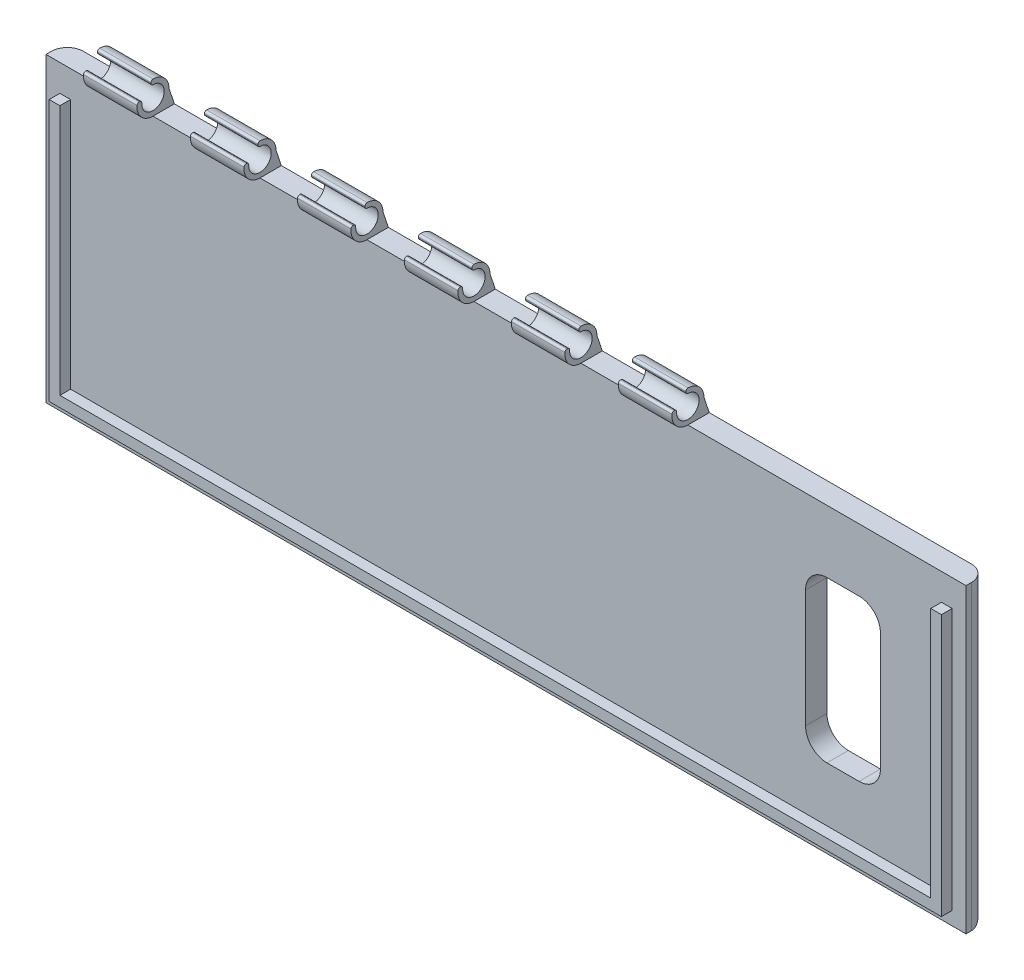
from build123d import *

# Parameters (mm, degrees)
SKETCH1_W               = 86
SKETCH1_H               = 28.2
BOSS_EXTRUDE1_DEPTH     = 2
SKETCH5_R               = 1.05
BOSS_EXTRUDE2_DEPTH     = 5
SKETCH8_W               = 1.75956426
SKETCH8_H               = 1.75956426
CUT_EXTRUDE3_DEPTH      = 5
FILLET4_R               = 0.2
LPATTERN1_COUNT         = 12
LPATTERN1_PITCH         = 5
LPATTERN1_2_COUNT       = 12
LPATTERN1_2_PITCH       = 5
FILLET4_OF_LPATTERN1_R  = 0.2
CUT_EXTRUDE1_START      = -43
CUT_EXTRUDE1_DEPTH      = 5
FILLET5_R               = 1.5
BOSS_EXTRUDE3_DEPTH     = 1
CUT_EXTRUDE6_DEPTH      = 47.407525329
CUT_EXTRUDE6_DEPTH_BACK = 47.407525329
SKETCH10_W              = 7
SKETCH10_H              = 15
FILLET6_R               = 2


# Read off the part's stored shape, not the designer's step: Cut-Extrude1
with BuildPart() as part:
    # Sketch1 → Boss-Extrude1 (new body)
    with BuildSketch(Plane.XY):
        Rectangle(SKETCH1_W, SKETCH1_H)
    extrude(amount=BOSS_EXTRUDE1_DEPTH)


with BuildPart() as body_2:
    # Sketch5 → Boss-Extrude2 (new body)
    with BuildSketch(Plane.ZY.offset(43)):
        with BuildLine():
            Line((0.5, 15.6), (0, 14.1))
            Line((0, 14.1), (2, 14.1))
            ThreePointArc((2, 14.1), (3.060660172, 16.660660172), (0.5, 15.6))
        make_face()
        with Locations((2, 15.6)):
            Circle(SKETCH5_R, mode=Mode.SUBTRACT)
    boss_extrude2 = extrude(amount=-BOSS_EXTRUDE2_DEPTH)

    # Sketch8 → Cut-Extrude3 (cut)
    with BuildSketch(Plane.ZY.offset(43)):
        with Locations((3.068777943, 16.78020761)):
            Rectangle(SKETCH8_W, SKETCH8_H)
    cut_extrude3 = extrude(amount=-CUT_EXTRUDE3_DEPTH, mode=Mode.SUBTRACT)

    # Fillet4
    fillet4_edges = [body_2.edges().sort_by_distance(p)[0] for p in [
        (-40.5, 16.632850707, 2.188995813),
        (-40.5, 15.90042548, 3.006103638),
        (-40.5, 17.088045894, 2.188995813),
        (-40.5, 15.90042548, 3.469606931),
    ]]
    fillet(fillet4_edges, radius=FILLET4_R)


with BuildPart() as part_1:
    add(part.part)

    add(body_2.part)  # LPattern1 merges body 2
    # LPattern1: Boss-Extrude2 ×12, 5 skipped
    with Locations(*[(i * LPATTERN1_PITCH, 0, 0) for i in range(1, LPATTERN1_COUNT) if i not in (2, 4, 6, 8, 10)]):
        add(boss_extrude2)

    # LPattern1 2: Cut-Extrude3 ×12, 5 skipped
    with Locations(*[(i * LPATTERN1_2_PITCH, 0, 0) for i in range(1, LPATTERN1_2_COUNT) if i not in (2, 4, 6, 8, 10)]):
        add(cut_extrude3, mode=Mode.SUBTRACT)

    # Fillet4 of LPattern1
    fillet4_of_lpattern1_edges = [part_1.edges().sort_by_distance(p)[0] for p in [
        (-35.5, 16.632850707, 2.188995813),
        (-35.5, 15.90042548, 3.006103638),
        (-35.5, 17.088045894, 2.188995813),
        (-35.5, 15.90042548, 3.469606931),
        (-25.5, 16.632850707, 2.188995813),
        (-25.5, 15.90042548, 3.006103638),
        (-25.5, 17.088045894, 2.188995813),
        (-25.5, 15.90042548, 3.469606931),
        (-15.5, 16.632850707, 2.188995813),
        (-15.5, 15.90042548, 3.006103638),
        (-15.5, 17.088045894, 2.188995813),
        (-15.5, 15.90042548, 3.469606931),
        (-5.5, 16.632850707, 2.188995813),
        (-5.5, 15.90042548, 3.006103638),
        (-5.5, 17.088045894, 2.188995813),
        (-5.5, 15.90042548, 3.469606931),
        (4.5, 16.632850707, 2.188995813),
        (4.5, 15.90042548, 3.006103638),
        (4.5, 17.088045894, 2.188995813),
        (4.5, 15.90042548, 3.469606931),
        (14.5, 16.632850707, 2.188995813),
        (14.5, 15.90042548, 3.006103638),
        (14.5, 17.088045894, 2.188995813),
        (14.5, 15.90042548, 3.469606931),
    ]]
    fillet(fillet4_of_lpattern1_edges, radius=FILLET4_OF_LPATTERN1_R)

    # Cut-Extrude1 outline → Cut-Extrude1 (cut)
    with BuildSketch(Plane.YZ.offset(CUT_EXTRUDE1_START)):
        with BuildLine():
            Line((14.1, 2), (14.1, 0))
            Line((14.1, 0), (15.6, 0.5))
            ThreePointArc((15.6, 0.5), (16.656161515, 0.934860171), (17.09994626, 1.987302861))
            ThreePointArc((17.09994626, 1.987302861), (17.041972069, 2.129817348), (16.899953425, 2.188995813))
            Line((16.899953425, 2.188995813), (16.849951562, 2.188995813))
            ThreePointArc((16.849951562, 2.188995813), (16.709154073, 2.131038296), (16.649959312, 1.990756483))
            ThreePointArc((16.649959312, 1.990756483), (14.825162546, 1.291390855), (15.684357403, 3.046605861))
            ThreePointArc((15.684357403, 3.046605861), (15.836046984, 3.098966816), (15.90042548, 3.245959359))
            Line((15.90042548, 3.245959359), (15.90042548, 3.296115243))
            ThreePointArc((15.90042548, 3.296115243), (15.847207656, 3.431964397), (15.715875553, 3.495517588))
            ThreePointArc((15.715875553, 3.495517588), (14.581131346, 3.100866325), (14.1, 2))
        make_face()
    extrude(amount=CUT_EXTRUDE1_DEPTH, mode=Mode.SUBTRACT)

    # Fillet5
    fillet5_edges = [part_1.edges().sort_by_distance(p)[0] for p in [
        (0, -14.1, 0),
        (-43, 0, 0),
        (43, 0, 0),
    ]]
    fillet(fillet5_edges, radius=FILLET5_R)

    # Sketch9 → Boss-Extrude3 (add)
    with BuildSketch(Plane.XY.offset(2)):
        Polygon((-41.7, 11.6), (-40.7, 11.6), (-40.7, -11.85), (40.7, -11.85), (40.7, 11.6), (41.7, 11.6), (41.7, -11.85), (41.7, -12.85), (-40.7, -12.85), (-41.7, -12.85), align=None)
    extrude(amount=BOSS_EXTRUDE3_DEPTH)

    # Sketch10 → Cut-Extrude6 (cut, two sides: drawn at the far end of the back side and taken through both)
    with BuildSketch(Plane(origin=(0, 0, 0), x_dir=(-1, 0, 0), z_dir=(0, 0, -1)).offset(-CUT_EXTRUDE6_DEPTH_BACK)):
        with Locations((-31.5, 0.75)):
            Rectangle(SKETCH10_W, SKETCH10_H)
    extrude(amount=CUT_EXTRUDE6_DEPTH + CUT_EXTRUDE6_DEPTH_BACK, mode=Mode.SUBTRACT)

    # Fillet6
    fillet6_edges = [part_1.edges().sort_by_distance(p)[0] for p in [
        (28, -6.75, 1),
        (28, 8.25, 1),
        (35, 8.25, 1),
        (35, -6.75, 1),
    ]]
    fillet(fillet6_edges, radius=FILLET6_R)


solid = part_1.part
